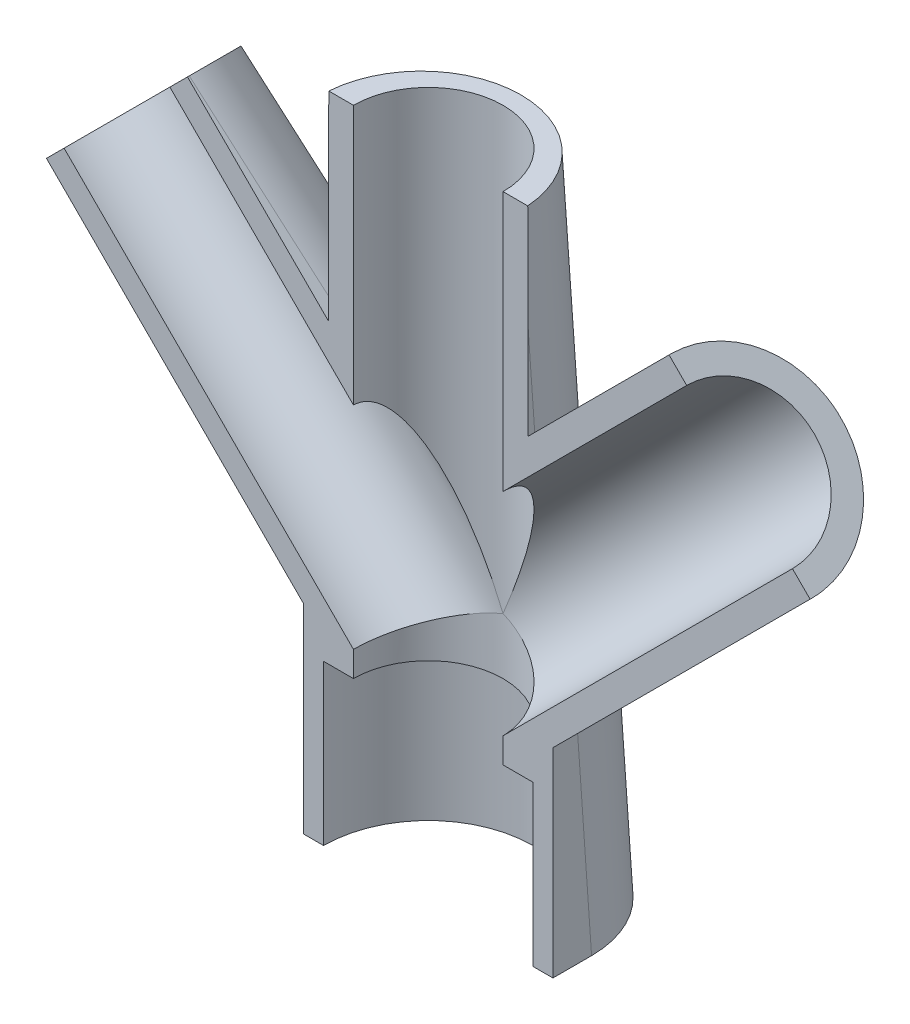
from build123d import *

# Parameters (mm, degrees)
EXTRUDE_634_DEPTH           = 12.5
SKETCH_4_R                  = 3.75
CUT_EXTRUDE_991_DEPTH       = 41.057008652
CUT_EXTRUDE_1141_REACH      = 47.49
CUT_EXTRUDE_1141_END_RADIUS = 3.75
SKETCH_5_R                  = 3.75
SKETCH_9_R                  = 5.25
CUT_EXTRUDE_1315_DEPTH      = 8
DRAFT_2_ANGLE               = 4
FILLET_8_R                  = 5
SKETCH_10_W                 = 49.037593782
SKETCH_10_H                 = 8.594475989
CUT_EXTRUDE_3_DEPTH         = 41.280697872


with BuildPart() as part:
    # Эскиз3 → Extrude 634 (new body)
    with BuildSketch(Plane.XY):
        Polygon((-6.25, 0), (-19.142135624, 12.892135624), (-12.071067812, 19.963203436), (-5, 12.892135624), (-5, 22.892135624), (5, 22.892135624), (5, 12.892135624), (12.071067812, 19.963203436), (19.142135624, 12.892135624), (6.25, 0), (6.25, -10), (-6.25, -10), align=None)
    extrude(amount=EXTRUDE_634_DEPTH)

    # Эскиз4 → Cut-Extrude 991 (cut, through all)
    with BuildSketch(Plane(origin=(0, 22.892135624, 0), x_dir=(-1, 0, 0), z_dir=(0, 1, 0))):
        with Locations(Location((0, 6.25, 0), (0, 0, 90))):
            Circle(SKETCH_4_R)
    extrude(amount=-CUT_EXTRUDE_991_DEPTH, mode=Mode.SUBTRACT)

    # Cut-Extrude 1141: up to this cylinder (the profile starts outside it)
    cut_extrude_1141_end = Plane(origin=(0, 16.42767, 6.25), z_dir=(0, 1, 0)) * Cylinder(CUT_EXTRUDE_1141_END_RADIUS, 103.48, mode=Mode.PRIVATE)
    # Эскиз5 → Cut-Extrude 1141 (cut, up to the surface)
    with BuildSketch(Plane(origin=(-16.017135624, 16.017135624, 0), x_dir=(0, 0, 1), z_dir=(-0.707106781186544, 0.7071067811865511, 0)), mode=Mode.PRIVATE) as cut_extrude_1141_sk1:
        with Locations(Location((6.25, 0.580582618, 0), (0, 0, 270))):
            Circle(SKETCH_5_R)
    cut_extrude_1141_tool1 = extrude(cut_extrude_1141_sk1.sketch, amount=-CUT_EXTRUDE_1141_REACH, mode=Mode.PRIVATE) - cut_extrude_1141_end
    cut_extrude_1141 = cut_extrude_1141_tool1.solids().sort_by_distance((-15.606602, 16.42767, 6.25))[0]
    add(cut_extrude_1141, mode=Mode.SUBTRACT)

    # Зеркальное отражение1: Cut-Extrude 1141 across plane
    add(cut_extrude_1141.mirror(Plane(origin=(0, 0, 0), x_dir=(0, 0, 1), z_dir=(1, 0, 0))), mode=Mode.SUBTRACT)

    # Эскиз9 → Cut-Extrude 1315 (cut)
    with BuildSketch(Plane.XZ.offset(10)):
        with Locations((0, 6.25)):
            Circle(SKETCH_9_R)
    extrude(amount=-CUT_EXTRUDE_1315_DEPTH, mode=Mode.SUBTRACT)

    # Уклон2
    draft_2_faces = [part.faces().sort_by_distance(p)[0] for p in [
        (0, 7.90429112, 0),
        (0, 7.90429112, 12.5),
    ]]
    draft(draft_2_faces, Plane.ZX, DRAFT_2_ANGLE)

    # Скругление8
    # the kernel refuses this fillet: 5 mm, written as the material it takes off along each edge
    with BuildSketch(Plane(origin=(-3.402831812, 4.489303811, 0.313922703), x_dir=(0.707968543318461, -0.7045235927201029, -0.049265088777904954), z_dir=(0.7062439675293066, 0.7062439675293118, 0.04938538910366094))) as fillet_8_piece_1_section:
        with BuildLine():
            CenterArc((FILLET_8_R * 0.951833326591, -FILLET_8_R), FILLET_8_R, 90, 87.17272264)
            Line((-FILLET_8_R * 0.0469494411747, -FILLET_8_R * 0.950674724384), (-FILLET_8_R * 0.06692509653, -FILLET_8_R * 0.949688218872))
            Line((-FILLET_8_R * 0.06692509653, -FILLET_8_R * 0.949688218872), (-FILLET_8_R * 0.0190366665318, FILLET_8_R * 0.02))
            Line((-FILLET_8_R * 0.0190366665318, FILLET_8_R * 0.02), (FILLET_8_R * 0.951833326591, FILLET_8_R * 0.02))
            Line((FILLET_8_R * 0.951833326591, FILLET_8_R * 0.02), (FILLET_8_R * 0.951833326591, 0))
        make_face()
    fillet_8_piece_1 = extrude(amount=33.8080501, mode=Mode.PRIVATE)
    fillet_8_piece_1 = split(fillet_8_piece_1, bisect_by=Plane(origin=(12.895577991, 19.138693257, 2.078418466), z_dir=(-0.7071067811865445, -0.7071067811865507, 0)), keep=Keep.TOP, mode=Mode.PRIVATE)
    fillet_8_piece_1 = split(fillet_8_piece_1, bisect_by=Plane(origin=(5, 15.190904261, 2.078418466), z_dir=(1, 0, 0)), keep=Keep.TOP, mode=Mode.PRIVATE)
    add(fillet_8_piece_1, mode=Mode.SUBTRACT)
    with BuildSketch(Plane(origin=(5, 35.361686252, 2.472729985), x_dir=(-1, 0, 0), z_dir=(0, -0.9975640502598243, -0.06975647374412541))) as fillet_8_piece_2_section:
        with BuildLine():
            CenterArc((FILLET_8_R, -FILLET_8_R), FILLET_8_R, 90, 90)
            Line((0, -FILLET_8_R), (-FILLET_8_R * 0.02, -FILLET_8_R))
            Line((-FILLET_8_R * 0.02, -FILLET_8_R), (-FILLET_8_R * 0.02, FILLET_8_R * 0.02))
            Line((-FILLET_8_R * 0.02, FILLET_8_R * 0.02), (FILLET_8_R, FILLET_8_R * 0.02))
            Line((FILLET_8_R, FILLET_8_R * 0.02), (FILLET_8_R, 0))
        make_face()
    fillet_8_piece_2 = extrude(amount=35.024418981, mode=Mode.PRIVATE)
    fillet_8_piece_2 = split(fillet_8_piece_2, bisect_by=Plane(origin=(3.763647995, 22.892135624, 2.280840285), z_dir=(0, -1, 0)), keep=Keep.TOP, mode=Mode.PRIVATE)
    fillet_8_piece_2 = split(fillet_8_piece_2, bisect_by=Plane(origin=(6.572735996, 14.46487162, 2.280840285), z_dir=(-0.7071067811865501, 0.707106781186545, 0)), keep=Keep.TOP, mode=Mode.PRIVATE)
    add(fillet_8_piece_2, mode=Mode.SUBTRACT)
    with BuildSketch(Plane(origin=(-5, 0.422584995, 0.029550022), x_dir=(1, 0, 0), z_dir=(0, 0.9975640502598243, 0.06975647374412541))) as fillet_8_piece_3_section:
        with BuildLine():
            CenterArc((FILLET_8_R, -FILLET_8_R), FILLET_8_R, 90, 90)
            Line((0, -FILLET_8_R), (-FILLET_8_R * 0.02, -FILLET_8_R))
            Line((-FILLET_8_R * 0.02, -FILLET_8_R), (-FILLET_8_R * 0.02, FILLET_8_R * 0.02))
            Line((-FILLET_8_R * 0.02, FILLET_8_R * 0.02), (FILLET_8_R, FILLET_8_R * 0.02))
            Line((FILLET_8_R, FILLET_8_R * 0.02), (FILLET_8_R, 0))
        make_face()
    fillet_8_piece_3 = extrude(amount=35.024418981, mode=Mode.PRIVATE)
    fillet_8_piece_3 = split(fillet_8_piece_3, bisect_by=Plane(origin=(-3.763647995, 22.892135624, 2.280840285), z_dir=(0, -1, 0)), keep=Keep.TOP, mode=Mode.PRIVATE)
    fillet_8_piece_3 = split(fillet_8_piece_3, bisect_by=Plane(origin=(-6.572735996, 14.46487162, 2.280840285), z_dir=(0.7071067811865512, 0.7071067811865438, 0)), keep=Keep.TOP, mode=Mode.PRIVATE)
    add(fillet_8_piece_3, mode=Mode.SUBTRACT)
    with BuildSketch(Plane(origin=(-20.473899624, 28.366035248, 1.983546412), x_dir=(-0.707968543318462, -0.7045235927201018, -0.04926508877790491), z_dir=(0.7062439675293055, -0.706243967529313, -0.04938538910366102))) as fillet_8_piece_4_section:
        with BuildLine():
            CenterArc((FILLET_8_R * 0.951833326591, -FILLET_8_R), FILLET_8_R, 90, 87.17272264)
            Line((-FILLET_8_R * 0.0469494411747, -FILLET_8_R * 0.950674724384), (-FILLET_8_R * 0.06692509653, -FILLET_8_R * 0.949688218872))
            Line((-FILLET_8_R * 0.06692509653, -FILLET_8_R * 0.949688218872), (-FILLET_8_R * 0.0190366665318, FILLET_8_R * 0.02))
            Line((-FILLET_8_R * 0.0190366665318, FILLET_8_R * 0.02), (FILLET_8_R * 0.951833326591, FILLET_8_R * 0.02))
            Line((FILLET_8_R * 0.951833326591, FILLET_8_R * 0.02), (FILLET_8_R * 0.951833326591, 0))
        make_face()
    fillet_8_piece_4 = extrude(amount=33.8080501, mode=Mode.PRIVATE)
    fillet_8_piece_4 = split(fillet_8_piece_4, bisect_by=Plane(origin=(-12.895577991, 19.138693257, 2.078418466), z_dir=(0.7071067811865444, -0.7071067811865508, 0)), keep=Keep.TOP, mode=Mode.PRIVATE)
    fillet_8_piece_4 = split(fillet_8_piece_4, bisect_by=Plane(origin=(-5, 15.190904261, 2.078418466), z_dir=(-1, 0, 0)), keep=Keep.TOP, mode=Mode.PRIVATE)
    add(fillet_8_piece_4, mode=Mode.SUBTRACT)
    with BuildSketch(Plane(origin=(3.024785141, -9.274785141, -0.648556156), x_dir=(0.034920743526734764, -0.034920743526734764, 0.9987797972241329), z_dir=(-0.7062439675293093, 0.7062439675293093, 0.04938538910366077))) as fillet_8_piece_5_section:
        with BuildLine():
            CenterArc((FILLET_8_R * 1.0506041048, FILLET_8_R), FILLET_8_R, 177.17272264, 92.82727736)
            Line((FILLET_8_R * 0.0518213370326, FILLET_8_R * 1.04932527562), (FILLET_8_R * 0.0318456816773, FILLET_8_R * 1.05031178113))
            Line((FILLET_8_R * 0.0318456816773, FILLET_8_R * 1.05031178113), (-FILLET_8_R * 0.021012082096, -FILLET_8_R * 0.02))
            Line((-FILLET_8_R * 0.021012082096, -FILLET_8_R * 0.02), (FILLET_8_R * 1.0506041048, -FILLET_8_R * 0.02))
            Line((FILLET_8_R * 1.0506041048, -FILLET_8_R * 0.02), (FILLET_8_R * 1.0506041048, 0))
        make_face()
    fillet_8_piece_5 = extrude(amount=44.519609867, mode=Mode.PRIVATE)
    fillet_8_piece_5 = split(fillet_8_piece_5, bisect_by=Plane(origin=(-6.25, 7.634264741, 1.775571736), z_dir=(-1, 0, 0)), keep=Keep.TOP, mode=Mode.PRIVATE)
    fillet_8_piece_5 = split(fillet_8_piece_5, bisect_by=Plane(origin=(-18.350004337, 13.68426691, 1.775571736), z_dir=(0.7071067811865444, -0.7071067811865508, 0)), keep=Keep.TOP, mode=Mode.PRIVATE)
    add(fillet_8_piece_5, mode=Mode.SUBTRACT)
    with BuildSketch(Plane(origin=(-6.25, -22.469550628, -1.571224041), x_dir=(0, -0.06975647374412541, 0.9975640502598242), z_dir=(0, 0.9975640502598243, 0.06975647374412541))) as fillet_8_piece_6_section:
        with BuildLine():
            CenterArc((FILLET_8_R, FILLET_8_R), FILLET_8_R, 180, 90)
            Line((0, FILLET_8_R), (-FILLET_8_R * 0.02, FILLET_8_R))
            Line((-FILLET_8_R * 0.02, FILLET_8_R), (-FILLET_8_R * 0.02, -FILLET_8_R * 0.02))
            Line((-FILLET_8_R * 0.02, -FILLET_8_R * 0.02), (FILLET_8_R, -FILLET_8_R * 0.02))
            Line((FILLET_8_R, -FILLET_8_R * 0.02), (FILLET_8_R, 0))
        make_face()
    fillet_8_piece_6 = extrude(amount=35.024418981, mode=Mode.PRIVATE)
    fillet_8_piece_6 = split(fillet_8_piece_6, bisect_by=Plane(origin=(-2.999285634, -3.250714366, 0.827701668), z_dir=(-0.7071067811865476, -0.7071067811865476, 0)), keep=Keep.TOP, mode=Mode.PRIVATE)
    fillet_8_piece_6 = split(fillet_8_piece_6, bisect_by=Plane(origin=(-5.249047512, -10, 0.827701668), z_dir=(0, 1, 0)), keep=Keep.TOP, mode=Mode.PRIVATE)
    add(fillet_8_piece_6, mode=Mode.SUBTRACT)
    with BuildSketch(Plane(origin=(6.25, 12.469550628, 0.871955922), x_dir=(-1, 0, 0), z_dir=(0, -0.9975640502598243, -0.06975647374412541))) as fillet_8_piece_7_section:
        with BuildLine():
            CenterArc((FILLET_8_R, -FILLET_8_R), FILLET_8_R, 90, 90)
            Line((0, -FILLET_8_R), (-FILLET_8_R * 0.02, -FILLET_8_R))
            Line((-FILLET_8_R * 0.02, -FILLET_8_R), (-FILLET_8_R * 0.02, FILLET_8_R * 0.02))
            Line((-FILLET_8_R * 0.02, FILLET_8_R * 0.02), (FILLET_8_R, FILLET_8_R * 0.02))
            Line((FILLET_8_R, FILLET_8_R * 0.02), (FILLET_8_R, 0))
        make_face()
    fillet_8_piece_7 = extrude(amount=35.024418981, mode=Mode.PRIVATE)
    fillet_8_piece_7 = split(fillet_8_piece_7, bisect_by=Plane(origin=(5.249047512, -10, 0.827701668), z_dir=(0, 1, 0)), keep=Keep.TOP, mode=Mode.PRIVATE)
    fillet_8_piece_7 = split(fillet_8_piece_7, bisect_by=Plane(origin=(2.999285634, -3.250714366, 0.827701668), z_dir=(0.7071067811865476, -0.7071067811865476, 0)), keep=Keep.TOP, mode=Mode.PRIVATE)
    add(fillet_8_piece_7, mode=Mode.SUBTRACT)
    with BuildSketch(Plane(origin=(28.416920765, 22.166920765, 1.5500621), x_dir=(-0.7079685433184584, 0.7045235927201055, 0.04926508877790521), z_dir=(-0.7062439675293093, -0.7062439675293093, -0.04938538910366077))) as fillet_8_piece_8_section:
        with BuildLine():
            CenterArc((FILLET_8_R * 1.0506041048, -FILLET_8_R), FILLET_8_R, 90, 92.82727736)
            Line((FILLET_8_R * 0.0518213370326, -FILLET_8_R * 1.04932527562), (FILLET_8_R * 0.0318456816773, -FILLET_8_R * 1.05031178113))
            Line((FILLET_8_R * 0.0318456816773, -FILLET_8_R * 1.05031178113), (-FILLET_8_R * 0.021012082096, FILLET_8_R * 0.02))
            Line((-FILLET_8_R * 0.021012082096, FILLET_8_R * 0.02), (FILLET_8_R * 1.0506041048, FILLET_8_R * 0.02))
            Line((FILLET_8_R * 1.0506041048, FILLET_8_R * 0.02), (FILLET_8_R * 1.0506041048, 0))
        make_face()
    fillet_8_piece_8 = extrude(amount=44.519609867, mode=Mode.PRIVATE)
    fillet_8_piece_8 = split(fillet_8_piece_8, bisect_by=Plane(origin=(18.350004337, 13.68426691, 1.775571736), z_dir=(-0.7071067811865445, -0.7071067811865507, 0)), keep=Keep.TOP, mode=Mode.PRIVATE)
    fillet_8_piece_8 = split(fillet_8_piece_8, bisect_by=Plane(origin=(6.25, 7.634264741, 1.775571736), z_dir=(1, 0, 0)), keep=Keep.TOP, mode=Mode.PRIVATE)
    add(fillet_8_piece_8, mode=Mode.SUBTRACT)
    with BuildSketch(Plane(origin=(-6.25, -22.469550628, 14.071224041), x_dir=(0, -0.06975647374412541, -0.9975640502598242), z_dir=(0, 0.9975640502598243, -0.06975647374412541))) as fillet_8_piece_9_section:
        with BuildLine():
            CenterArc((FILLET_8_R, -FILLET_8_R), FILLET_8_R, 90, 90)
            Line((0, -FILLET_8_R), (-FILLET_8_R * 0.02, -FILLET_8_R))
            Line((-FILLET_8_R * 0.02, -FILLET_8_R), (-FILLET_8_R * 0.02, FILLET_8_R * 0.02))
            Line((-FILLET_8_R * 0.02, FILLET_8_R * 0.02), (FILLET_8_R, FILLET_8_R * 0.02))
            Line((FILLET_8_R, FILLET_8_R * 0.02), (FILLET_8_R, 0))
        make_face()
    fillet_8_piece_9 = extrude(amount=35.024418981, mode=Mode.PRIVATE)
    fillet_8_piece_9 = split(fillet_8_piece_9, bisect_by=Plane(origin=(-2.999285634, -3.250714366, 11.672298332), z_dir=(-0.7071067811865476, -0.7071067811865476, 0)), keep=Keep.TOP, mode=Mode.PRIVATE)
    fillet_8_piece_9 = split(fillet_8_piece_9, bisect_by=Plane(origin=(-5.249047512, -10, 11.672298332), z_dir=(0, 1, 0)), keep=Keep.TOP, mode=Mode.PRIVATE)
    add(fillet_8_piece_9, mode=Mode.SUBTRACT)
    with BuildSketch(Plane(origin=(6.25, 12.469550628, 11.628044078), x_dir=(-1, 0, 0), z_dir=(0, -0.9975640502598243, 0.06975647374412541))) as fillet_8_piece_10_section:
        with BuildLine():
            CenterArc((FILLET_8_R, FILLET_8_R), FILLET_8_R, 180, 90)
            Line((0, FILLET_8_R), (-FILLET_8_R * 0.02, FILLET_8_R))
            Line((-FILLET_8_R * 0.02, FILLET_8_R), (-FILLET_8_R * 0.02, -FILLET_8_R * 0.02))
            Line((-FILLET_8_R * 0.02, -FILLET_8_R * 0.02), (FILLET_8_R, -FILLET_8_R * 0.02))
            Line((FILLET_8_R, -FILLET_8_R * 0.02), (FILLET_8_R, 0))
        make_face()
    fillet_8_piece_10 = extrude(amount=35.024418981, mode=Mode.PRIVATE)
    fillet_8_piece_10 = split(fillet_8_piece_10, bisect_by=Plane(origin=(5.249047512, -10, 11.672298332), z_dir=(0, 1, 0)), keep=Keep.TOP, mode=Mode.PRIVATE)
    fillet_8_piece_10 = split(fillet_8_piece_10, bisect_by=Plane(origin=(2.999285634, -3.250714366, 11.672298332), z_dir=(0.7071067811865476, -0.7071067811865476, 0)), keep=Keep.TOP, mode=Mode.PRIVATE)
    add(fillet_8_piece_10, mode=Mode.SUBTRACT)
    with BuildSketch(Plane(origin=(28.416920765, 22.166920765, 10.9499379), x_dir=(-0.7079685433184584, 0.7045235927201055, -0.049265088777905426), z_dir=(-0.7062439675293093, -0.7062439675293093, 0.04938538910366077))) as fillet_8_piece_11_section:
        with BuildLine():
            CenterArc((FILLET_8_R * 1.0506041048, FILLET_8_R), FILLET_8_R, 177.17272264, 92.82727736)
            Line((FILLET_8_R * 0.0518213370326, FILLET_8_R * 1.04932527562), (FILLET_8_R * 0.0318456816773, FILLET_8_R * 1.05031178113))
            Line((FILLET_8_R * 0.0318456816773, FILLET_8_R * 1.05031178113), (-FILLET_8_R * 0.021012082096, -FILLET_8_R * 0.02))
            Line((-FILLET_8_R * 0.021012082096, -FILLET_8_R * 0.02), (FILLET_8_R * 1.0506041048, -FILLET_8_R * 0.02))
            Line((FILLET_8_R * 1.0506041048, -FILLET_8_R * 0.02), (FILLET_8_R * 1.0506041048, 0))
        make_face()
    fillet_8_piece_11 = extrude(amount=44.519609867, mode=Mode.PRIVATE)
    fillet_8_piece_11 = split(fillet_8_piece_11, bisect_by=Plane(origin=(18.350004337, 13.68426691, 10.724428264), z_dir=(-0.7071067811865445, -0.7071067811865507, 0)), keep=Keep.TOP, mode=Mode.PRIVATE)
    fillet_8_piece_11 = split(fillet_8_piece_11, bisect_by=Plane(origin=(6.25, 7.634264741, 10.724428264), z_dir=(1, 0, 0)), keep=Keep.TOP, mode=Mode.PRIVATE)
    add(fillet_8_piece_11, mode=Mode.SUBTRACT)
    with BuildSketch(Plane(origin=(-3.402831812, 4.489303811, 12.186077297), x_dir=(0.707968543318461, -0.7045235927201029, 0.04926508877790491), z_dir=(0.7062439675293066, 0.7062439675293118, -0.04938538910366094))) as fillet_8_piece_12_section:
        with BuildLine():
            CenterArc((FILLET_8_R * 0.951833326591, FILLET_8_R), FILLET_8_R, 182.82727736, 87.17272264)
            Line((-FILLET_8_R * 0.0469494411747, FILLET_8_R * 0.950674724384), (-FILLET_8_R * 0.06692509653, FILLET_8_R * 0.949688218872))
            Line((-FILLET_8_R * 0.06692509653, FILLET_8_R * 0.949688218872), (-FILLET_8_R * 0.0190366665318, -FILLET_8_R * 0.02))
            Line((-FILLET_8_R * 0.0190366665318, -FILLET_8_R * 0.02), (FILLET_8_R * 0.951833326591, -FILLET_8_R * 0.02))
            Line((FILLET_8_R * 0.951833326591, -FILLET_8_R * 0.02), (FILLET_8_R * 0.951833326591, 0))
        make_face()
    fillet_8_piece_12 = extrude(amount=33.8080501, mode=Mode.PRIVATE)
    fillet_8_piece_12 = split(fillet_8_piece_12, bisect_by=Plane(origin=(12.895577991, 19.138693257, 10.421581534), z_dir=(-0.7071067811865445, -0.7071067811865507, 0)), keep=Keep.TOP, mode=Mode.PRIVATE)
    fillet_8_piece_12 = split(fillet_8_piece_12, bisect_by=Plane(origin=(5, 15.190904261, 10.421581534), z_dir=(1, 0, 0)), keep=Keep.TOP, mode=Mode.PRIVATE)
    add(fillet_8_piece_12, mode=Mode.SUBTRACT)
    with BuildSketch(Plane(origin=(5, 35.361686252, 10.027270015), x_dir=(-1, 0, 0), z_dir=(0, -0.9975640502598243, 0.06975647374412541))) as fillet_8_piece_13_section:
        with BuildLine():
            CenterArc((FILLET_8_R, FILLET_8_R), FILLET_8_R, 180, 90)
            Line((0, FILLET_8_R), (-FILLET_8_R * 0.02, FILLET_8_R))
            Line((-FILLET_8_R * 0.02, FILLET_8_R), (-FILLET_8_R * 0.02, -FILLET_8_R * 0.02))
            Line((-FILLET_8_R * 0.02, -FILLET_8_R * 0.02), (FILLET_8_R, -FILLET_8_R * 0.02))
            Line((FILLET_8_R, -FILLET_8_R * 0.02), (FILLET_8_R, 0))
        make_face()
    fillet_8_piece_13 = extrude(amount=35.024418981, mode=Mode.PRIVATE)
    fillet_8_piece_13 = split(fillet_8_piece_13, bisect_by=Plane(origin=(3.763647995, 22.892135624, 10.219159715), z_dir=(0, -1, 0)), keep=Keep.TOP, mode=Mode.PRIVATE)
    fillet_8_piece_13 = split(fillet_8_piece_13, bisect_by=Plane(origin=(6.572735996, 14.46487162, 10.219159715), z_dir=(-0.7071067811865501, 0.707106781186545, 0)), keep=Keep.TOP, mode=Mode.PRIVATE)
    add(fillet_8_piece_13, mode=Mode.SUBTRACT)
    with BuildSketch(Plane(origin=(-5, 0.422584995, 12.470449978), x_dir=(1, 0, 0), z_dir=(0, 0.9975640502598243, -0.06975647374412541))) as fillet_8_piece_14_section:
        with BuildLine():
            CenterArc((FILLET_8_R, FILLET_8_R), FILLET_8_R, 180, 90)
            Line((0, FILLET_8_R), (-FILLET_8_R * 0.02, FILLET_8_R))
            Line((-FILLET_8_R * 0.02, FILLET_8_R), (-FILLET_8_R * 0.02, -FILLET_8_R * 0.02))
            Line((-FILLET_8_R * 0.02, -FILLET_8_R * 0.02), (FILLET_8_R, -FILLET_8_R * 0.02))
            Line((FILLET_8_R, -FILLET_8_R * 0.02), (FILLET_8_R, 0))
        make_face()
    fillet_8_piece_14 = extrude(amount=35.024418981, mode=Mode.PRIVATE)
    fillet_8_piece_14 = split(fillet_8_piece_14, bisect_by=Plane(origin=(-3.763647995, 22.892135624, 10.219159715), z_dir=(0, -1, 0)), keep=Keep.TOP, mode=Mode.PRIVATE)
    fillet_8_piece_14 = split(fillet_8_piece_14, bisect_by=Plane(origin=(-6.572735996, 14.46487162, 10.219159715), z_dir=(0.7071067811865512, 0.7071067811865438, 0)), keep=Keep.TOP, mode=Mode.PRIVATE)
    add(fillet_8_piece_14, mode=Mode.SUBTRACT)
    with BuildSketch(Plane(origin=(-20.473899624, 28.366035248, 10.516453588), x_dir=(-0.7079685433184622, -0.7045235927201017, 0.04926508877790538), z_dir=(0.7062439675293055, -0.706243967529313, 0.04938538910366102))) as fillet_8_piece_15_section:
        with BuildLine():
            CenterArc((FILLET_8_R * 0.951833326591, FILLET_8_R), FILLET_8_R, 182.82727736, 87.17272264)
            Line((-FILLET_8_R * 0.0469494411747, FILLET_8_R * 0.950674724384), (-FILLET_8_R * 0.06692509653, FILLET_8_R * 0.949688218872))
            Line((-FILLET_8_R * 0.06692509653, FILLET_8_R * 0.949688218872), (-FILLET_8_R * 0.0190366665318, -FILLET_8_R * 0.02))
            Line((-FILLET_8_R * 0.0190366665318, -FILLET_8_R * 0.02), (FILLET_8_R * 0.951833326591, -FILLET_8_R * 0.02))
            Line((FILLET_8_R * 0.951833326591, -FILLET_8_R * 0.02), (FILLET_8_R * 0.951833326591, 0))
        make_face()
    fillet_8_piece_15 = extrude(amount=33.8080501, mode=Mode.PRIVATE)
    fillet_8_piece_15 = split(fillet_8_piece_15, bisect_by=Plane(origin=(-12.895577991, 19.138693257, 10.421581534), z_dir=(0.7071067811865444, -0.7071067811865508, 0)), keep=Keep.TOP, mode=Mode.PRIVATE)
    fillet_8_piece_15 = split(fillet_8_piece_15, bisect_by=Plane(origin=(-5, 15.190904261, 10.421581534), z_dir=(-1, 0, 0)), keep=Keep.TOP, mode=Mode.PRIVATE)
    add(fillet_8_piece_15, mode=Mode.SUBTRACT)
    with BuildSketch(Plane(origin=(3.024785141, -9.274785141, 13.148556156), x_dir=(0.034920743526734764, -0.034920743526734764, -0.9987797972241329), z_dir=(-0.7062439675293093, 0.7062439675293093, -0.04938538910366077))) as fillet_8_piece_16_section:
        with BuildLine():
            CenterArc((FILLET_8_R * 1.0506041048, -FILLET_8_R), FILLET_8_R, 90, 92.82727736)
            Line((FILLET_8_R * 0.0518213370326, -FILLET_8_R * 1.04932527562), (FILLET_8_R * 0.0318456816773, -FILLET_8_R * 1.05031178113))
            Line((FILLET_8_R * 0.0318456816773, -FILLET_8_R * 1.05031178113), (-FILLET_8_R * 0.021012082096, FILLET_8_R * 0.02))
            Line((-FILLET_8_R * 0.021012082096, FILLET_8_R * 0.02), (FILLET_8_R * 1.0506041048, FILLET_8_R * 0.02))
            Line((FILLET_8_R * 1.0506041048, FILLET_8_R * 0.02), (FILLET_8_R * 1.0506041048, 0))
        make_face()
    fillet_8_piece_16 = extrude(amount=44.519609867, mode=Mode.PRIVATE)
    fillet_8_piece_16 = split(fillet_8_piece_16, bisect_by=Plane(origin=(-6.25, 7.634264741, 10.724428264), z_dir=(-1, 0, 0)), keep=Keep.TOP, mode=Mode.PRIVATE)
    fillet_8_piece_16 = split(fillet_8_piece_16, bisect_by=Plane(origin=(-18.350004337, 13.68426691, 10.724428264), z_dir=(0.7071067811865444, -0.7071067811865508, 0)), keep=Keep.TOP, mode=Mode.PRIVATE)
    add(fillet_8_piece_16, mode=Mode.SUBTRACT)
    with BuildSketch(Plane(origin=(5, 35.361686252, 2.472729985), x_dir=(-1, 0, 0), z_dir=(0, -0.9975640502598243, -0.06975647374412541))) as fillet_8_piece_17a_section:
        with BuildLine():
            CenterArc((FILLET_8_R, -FILLET_8_R), FILLET_8_R, 90, 90)
            Line((0, -FILLET_8_R), (-FILLET_8_R * 0.02, -FILLET_8_R))
            Line((-FILLET_8_R * 0.02, -FILLET_8_R), (-FILLET_8_R * 0.02, FILLET_8_R * 0.02))
            Line((-FILLET_8_R * 0.02, FILLET_8_R * 0.02), (FILLET_8_R, FILLET_8_R * 0.02))
            Line((FILLET_8_R, FILLET_8_R * 0.02), (FILLET_8_R, 0))
        make_face()
    fillet_8_piece_17a = extrude(amount=35.024418981, mode=Mode.PRIVATE)
    fillet_8_piece_17a = split(fillet_8_piece_17a, bisect_by=Plane(origin=(1.092194354, 8.984329978, 1.628858747), z_dir=(0.7071067811865501, -0.707106781186545, 0)), keep=Keep.TOP, mode=Mode.PRIVATE)
    with BuildSketch(Plane(origin=(-3.402831812, 4.489303811, 0.313922703), x_dir=(0.707968543318461, -0.7045235927201029, -0.049265088777904954), z_dir=(0.7062439675293066, 0.7062439675293118, 0.04938538910366094))) as fillet_8_piece_17b_section:
        with BuildLine():
            CenterArc((FILLET_8_R * 0.951833326591, -FILLET_8_R), FILLET_8_R, 90, 87.17272264)
            Line((-FILLET_8_R * 0.0469494411747, -FILLET_8_R * 0.950674724384), (-FILLET_8_R * 0.06692509653, -FILLET_8_R * 0.949688218872))
            Line((-FILLET_8_R * 0.06692509653, -FILLET_8_R * 0.949688218872), (-FILLET_8_R * 0.0190366665318, FILLET_8_R * 0.02))
            Line((-FILLET_8_R * 0.0190366665318, FILLET_8_R * 0.02), (FILLET_8_R * 0.951833326591, FILLET_8_R * 0.02))
            Line((FILLET_8_R * 0.951833326591, FILLET_8_R * 0.02), (FILLET_8_R * 0.951833326591, 0))
        make_face()
    fillet_8_piece_17b = extrude(amount=33.8080501, mode=Mode.PRIVATE)
    fillet_8_piece_17b = split(fillet_8_piece_17b, bisect_by=Plane(origin=(5, 7.643322174, 1.670148542), z_dir=(-1, 0, 0)), keep=Keep.TOP, mode=Mode.PRIVATE)
    fillet_8_piece_17 = fillet_8_piece_17a & fillet_8_piece_17b
    add(fillet_8_piece_17, mode=Mode.SUBTRACT)
    with BuildSketch(Plane(origin=(-20.473899624, 28.366035248, 1.983546412), x_dir=(-0.707968543318462, -0.7045235927201018, -0.04926508877790491), z_dir=(0.7062439675293055, -0.706243967529313, -0.04938538910366102))) as fillet_8_piece_18a_section:
        with BuildLine():
            CenterArc((FILLET_8_R * 0.951833326591, -FILLET_8_R), FILLET_8_R, 90, 87.17272264)
            Line((-FILLET_8_R * 0.0469494411747, -FILLET_8_R * 0.950674724384), (-FILLET_8_R * 0.06692509653, -FILLET_8_R * 0.949688218872))
            Line((-FILLET_8_R * 0.06692509653, -FILLET_8_R * 0.949688218872), (-FILLET_8_R * 0.0190366665318, FILLET_8_R * 0.02))
            Line((-FILLET_8_R * 0.0190366665318, FILLET_8_R * 0.02), (FILLET_8_R * 0.951833326591, FILLET_8_R * 0.02))
            Line((FILLET_8_R * 0.951833326591, FILLET_8_R * 0.02), (FILLET_8_R * 0.951833326591, 0))
        make_face()
    fillet_8_piece_18a = extrude(amount=33.8080501, mode=Mode.PRIVATE)
    fillet_8_piece_18a = split(fillet_8_piece_18a, bisect_by=Plane(origin=(-5, 7.643322174, 1.670148542), z_dir=(1, 0, 0)), keep=Keep.TOP, mode=Mode.PRIVATE)
    with BuildSketch(Plane(origin=(-5, 0.422584995, 0.029550022), x_dir=(1, 0, 0), z_dir=(0, 0.9975640502598243, 0.06975647374412541))) as fillet_8_piece_18b_section:
        with BuildLine():
            CenterArc((FILLET_8_R, -FILLET_8_R), FILLET_8_R, 90, 90)
            Line((0, -FILLET_8_R), (-FILLET_8_R * 0.02, -FILLET_8_R))
            Line((-FILLET_8_R * 0.02, -FILLET_8_R), (-FILLET_8_R * 0.02, FILLET_8_R * 0.02))
            Line((-FILLET_8_R * 0.02, FILLET_8_R * 0.02), (FILLET_8_R, FILLET_8_R * 0.02))
            Line((FILLET_8_R, FILLET_8_R * 0.02), (FILLET_8_R, 0))
        make_face()
    fillet_8_piece_18b = extrude(amount=35.024418981, mode=Mode.PRIVATE)
    fillet_8_piece_18b = split(fillet_8_piece_18b, bisect_by=Plane(origin=(-1.092194354, 8.984329978, 1.628858747), z_dir=(-0.7071067811865512, -0.7071067811865438, 0)), keep=Keep.TOP, mode=Mode.PRIVATE)
    fillet_8_piece_18 = fillet_8_piece_18a & fillet_8_piece_18b
    add(fillet_8_piece_18, mode=Mode.SUBTRACT)
    with BuildSketch(Plane(origin=(3.024785141, -9.274785141, -0.648556156), x_dir=(0.034920743526734764, -0.034920743526734764, 0.9987797972241329), z_dir=(-0.7062439675293093, 0.7062439675293093, 0.04938538910366077))) as fillet_8_piece_19a_section:
        with BuildLine():
            CenterArc((FILLET_8_R * 1.0506041048, FILLET_8_R), FILLET_8_R, 177.17272264, 92.82727736)
            Line((FILLET_8_R * 0.0518213370326, FILLET_8_R * 1.04932527562), (FILLET_8_R * 0.0318456816773, FILLET_8_R * 1.05031178113))
            Line((FILLET_8_R * 0.0318456816773, FILLET_8_R * 1.05031178113), (-FILLET_8_R * 0.021012082096, -FILLET_8_R * 0.02))
            Line((-FILLET_8_R * 0.021012082096, -FILLET_8_R * 0.02), (FILLET_8_R * 1.0506041048, -FILLET_8_R * 0.02))
            Line((FILLET_8_R * 1.0506041048, -FILLET_8_R * 0.02), (FILLET_8_R * 1.0506041048, 0))
        make_face()
    fillet_8_piece_19a = extrude(amount=44.519609867, mode=Mode.PRIVATE)
    fillet_8_piece_19a = split(fillet_8_piece_19a, bisect_by=Plane(origin=(-6.25, -3.300210826, 0.918854804), z_dir=(1, 0, 0)), keep=Keep.TOP, mode=Mode.PRIVATE)
    with BuildSketch(Plane(origin=(-6.25, -22.469550628, -1.571224041), x_dir=(0, -0.06975647374412541, 0.9975640502598242), z_dir=(0, 0.9975640502598243, 0.06975647374412541))) as fillet_8_piece_19b_section:
        with BuildLine():
            CenterArc((FILLET_8_R, FILLET_8_R), FILLET_8_R, 180, 90)
            Line((0, FILLET_8_R), (-FILLET_8_R * 0.02, FILLET_8_R))
            Line((-FILLET_8_R * 0.02, FILLET_8_R), (-FILLET_8_R * 0.02, -FILLET_8_R * 0.02))
            Line((-FILLET_8_R * 0.02, -FILLET_8_R * 0.02), (FILLET_8_R, -FILLET_8_R * 0.02))
            Line((FILLET_8_R, -FILLET_8_R * 0.02), (FILLET_8_R, 0))
        make_face()
    fillet_8_piece_19b = extrude(amount=35.024418981, mode=Mode.PRIVATE)
    fillet_8_piece_19b = split(fillet_8_piece_19b, bisect_by=Plane(origin=(-8.432556222, 2.182556222, 1.468496312), z_dir=(0.7071067811865476, 0.7071067811865476, 0)), keep=Keep.TOP, mode=Mode.PRIVATE)
    fillet_8_piece_19 = fillet_8_piece_19a & fillet_8_piece_19b
    add(fillet_8_piece_19, mode=Mode.SUBTRACT)
    with BuildSketch(Plane(origin=(28.416920765, 22.166920765, 1.5500621), x_dir=(-0.7079685433184584, 0.7045235927201055, 0.04926508877790521), z_dir=(-0.7062439675293093, -0.7062439675293093, -0.04938538910366077))) as fillet_8_piece_20a_section:
        with BuildLine():
            CenterArc((FILLET_8_R * 1.0506041048, -FILLET_8_R), FILLET_8_R, 90, 92.82727736)
            Line((FILLET_8_R * 0.0518213370326, -FILLET_8_R * 1.04932527562), (FILLET_8_R * 0.0318456816773, -FILLET_8_R * 1.05031178113))
            Line((FILLET_8_R * 0.0318456816773, -FILLET_8_R * 1.05031178113), (-FILLET_8_R * 0.021012082096, FILLET_8_R * 0.02))
            Line((-FILLET_8_R * 0.021012082096, FILLET_8_R * 0.02), (FILLET_8_R * 1.0506041048, FILLET_8_R * 0.02))
            Line((FILLET_8_R * 1.0506041048, FILLET_8_R * 0.02), (FILLET_8_R * 1.0506041048, 0))
        make_face()
    fillet_8_piece_20a = extrude(amount=44.519609867, mode=Mode.PRIVATE)
    fillet_8_piece_20a = split(fillet_8_piece_20a, bisect_by=Plane(origin=(6.25, -3.300210826, 0.918854804), z_dir=(-1, 0, 0)), keep=Keep.TOP, mode=Mode.PRIVATE)
    with BuildSketch(Plane(origin=(6.25, 12.469550628, 0.871955922), x_dir=(-1, 0, 0), z_dir=(0, -0.9975640502598243, -0.06975647374412541))) as fillet_8_piece_20b_section:
        with BuildLine():
            CenterArc((FILLET_8_R, -FILLET_8_R), FILLET_8_R, 90, 90)
            Line((0, -FILLET_8_R), (-FILLET_8_R * 0.02, -FILLET_8_R))
            Line((-FILLET_8_R * 0.02, -FILLET_8_R), (-FILLET_8_R * 0.02, FILLET_8_R * 0.02))
            Line((-FILLET_8_R * 0.02, FILLET_8_R * 0.02), (FILLET_8_R, FILLET_8_R * 0.02))
            Line((FILLET_8_R, FILLET_8_R * 0.02), (FILLET_8_R, 0))
        make_face()
    fillet_8_piece_20b = extrude(amount=35.024418981, mode=Mode.PRIVATE)
    fillet_8_piece_20b = split(fillet_8_piece_20b, bisect_by=Plane(origin=(8.432556222, 2.182556222, 1.468496312), z_dir=(-0.7071067811865476, 0.7071067811865476, 0)), keep=Keep.TOP, mode=Mode.PRIVATE)
    fillet_8_piece_20 = fillet_8_piece_20a & fillet_8_piece_20b
    add(fillet_8_piece_20, mode=Mode.SUBTRACT)
    with BuildSketch(Plane(origin=(3.024785141, -9.274785141, 13.148556156), x_dir=(0.034920743526734764, -0.034920743526734764, -0.9987797972241329), z_dir=(-0.7062439675293093, 0.7062439675293093, -0.04938538910366077))) as fillet_8_piece_21a_section:
        with BuildLine():
            CenterArc((FILLET_8_R * 1.0506041048, -FILLET_8_R), FILLET_8_R, 90, 92.82727736)
            Line((FILLET_8_R * 0.0518213370326, -FILLET_8_R * 1.04932527562), (FILLET_8_R * 0.0318456816773, -FILLET_8_R * 1.05031178113))
            Line((FILLET_8_R * 0.0318456816773, -FILLET_8_R * 1.05031178113), (-FILLET_8_R * 0.021012082096, FILLET_8_R * 0.02))
            Line((-FILLET_8_R * 0.021012082096, FILLET_8_R * 0.02), (FILLET_8_R * 1.0506041048, FILLET_8_R * 0.02))
            Line((FILLET_8_R * 1.0506041048, FILLET_8_R * 0.02), (FILLET_8_R * 1.0506041048, 0))
        make_face()
    fillet_8_piece_21a = extrude(amount=44.519609867, mode=Mode.PRIVATE)
    fillet_8_piece_21a = split(fillet_8_piece_21a, bisect_by=Plane(origin=(-6.25, -3.300210826, 11.581145196), z_dir=(1, 0, 0)), keep=Keep.TOP, mode=Mode.PRIVATE)
    with BuildSketch(Plane(origin=(-6.25, -22.469550628, 14.071224041), x_dir=(0, -0.06975647374412541, -0.9975640502598242), z_dir=(0, 0.9975640502598243, -0.06975647374412541))) as fillet_8_piece_21b_section:
        with BuildLine():
            CenterArc((FILLET_8_R, -FILLET_8_R), FILLET_8_R, 90, 90)
            Line((0, -FILLET_8_R), (-FILLET_8_R * 0.02, -FILLET_8_R))
            Line((-FILLET_8_R * 0.02, -FILLET_8_R), (-FILLET_8_R * 0.02, FILLET_8_R * 0.02))
            Line((-FILLET_8_R * 0.02, FILLET_8_R * 0.02), (FILLET_8_R, FILLET_8_R * 0.02))
            Line((FILLET_8_R, FILLET_8_R * 0.02), (FILLET_8_R, 0))
        make_face()
    fillet_8_piece_21b = extrude(amount=35.024418981, mode=Mode.PRIVATE)
    fillet_8_piece_21b = split(fillet_8_piece_21b, bisect_by=Plane(origin=(-8.432556222, 2.182556222, 11.031503688), z_dir=(0.7071067811865476, 0.7071067811865476, 0)), keep=Keep.TOP, mode=Mode.PRIVATE)
    fillet_8_piece_21 = fillet_8_piece_21a & fillet_8_piece_21b
    add(fillet_8_piece_21, mode=Mode.SUBTRACT)
    with BuildSketch(Plane(origin=(28.416920765, 22.166920765, 10.9499379), x_dir=(-0.7079685433184584, 0.7045235927201055, -0.049265088777905426), z_dir=(-0.7062439675293093, -0.7062439675293093, 0.04938538910366077))) as fillet_8_piece_22a_section:
        with BuildLine():
            CenterArc((FILLET_8_R * 1.0506041048, FILLET_8_R), FILLET_8_R, 177.17272264, 92.82727736)
            Line((FILLET_8_R * 0.0518213370326, FILLET_8_R * 1.04932527562), (FILLET_8_R * 0.0318456816773, FILLET_8_R * 1.05031178113))
            Line((FILLET_8_R * 0.0318456816773, FILLET_8_R * 1.05031178113), (-FILLET_8_R * 0.021012082096, -FILLET_8_R * 0.02))
            Line((-FILLET_8_R * 0.021012082096, -FILLET_8_R * 0.02), (FILLET_8_R * 1.0506041048, -FILLET_8_R * 0.02))
            Line((FILLET_8_R * 1.0506041048, -FILLET_8_R * 0.02), (FILLET_8_R * 1.0506041048, 0))
        make_face()
    fillet_8_piece_22a = extrude(amount=44.519609867, mode=Mode.PRIVATE)
    fillet_8_piece_22a = split(fillet_8_piece_22a, bisect_by=Plane(origin=(6.25, -3.300210826, 11.581145196), z_dir=(-1, 0, 0)), keep=Keep.TOP, mode=Mode.PRIVATE)
    with BuildSketch(Plane(origin=(6.25, 12.469550628, 11.628044078), x_dir=(-1, 0, 0), z_dir=(0, -0.9975640502598243, 0.06975647374412541))) as fillet_8_piece_22b_section:
        with BuildLine():
            CenterArc((FILLET_8_R, FILLET_8_R), FILLET_8_R, 180, 90)
            Line((0, FILLET_8_R), (-FILLET_8_R * 0.02, FILLET_8_R))
            Line((-FILLET_8_R * 0.02, FILLET_8_R), (-FILLET_8_R * 0.02, -FILLET_8_R * 0.02))
            Line((-FILLET_8_R * 0.02, -FILLET_8_R * 0.02), (FILLET_8_R, -FILLET_8_R * 0.02))
            Line((FILLET_8_R, -FILLET_8_R * 0.02), (FILLET_8_R, 0))
        make_face()
    fillet_8_piece_22b = extrude(amount=35.024418981, mode=Mode.PRIVATE)
    fillet_8_piece_22b = split(fillet_8_piece_22b, bisect_by=Plane(origin=(8.432556222, 2.182556222, 11.031503688), z_dir=(-0.7071067811865476, 0.7071067811865476, 0)), keep=Keep.TOP, mode=Mode.PRIVATE)
    fillet_8_piece_22 = fillet_8_piece_22a & fillet_8_piece_22b
    add(fillet_8_piece_22, mode=Mode.SUBTRACT)
    with BuildSketch(Plane(origin=(5, 35.361686252, 10.027270015), x_dir=(-1, 0, 0), z_dir=(0, -0.9975640502598243, 0.06975647374412541))) as fillet_8_piece_23a_section:
        with BuildLine():
            CenterArc((FILLET_8_R, FILLET_8_R), FILLET_8_R, 180, 90)
            Line((0, FILLET_8_R), (-FILLET_8_R * 0.02, FILLET_8_R))
            Line((-FILLET_8_R * 0.02, FILLET_8_R), (-FILLET_8_R * 0.02, -FILLET_8_R * 0.02))
            Line((-FILLET_8_R * 0.02, -FILLET_8_R * 0.02), (FILLET_8_R, -FILLET_8_R * 0.02))
            Line((FILLET_8_R, -FILLET_8_R * 0.02), (FILLET_8_R, 0))
        make_face()
    fillet_8_piece_23a = extrude(amount=35.024418981, mode=Mode.PRIVATE)
    fillet_8_piece_23a = split(fillet_8_piece_23a, bisect_by=Plane(origin=(1.092194354, 8.984329978, 10.871141253), z_dir=(0.7071067811865501, -0.707106781186545, 0)), keep=Keep.TOP, mode=Mode.PRIVATE)
    with BuildSketch(Plane(origin=(-3.402831812, 4.489303811, 12.186077297), x_dir=(0.707968543318461, -0.7045235927201029, 0.04926508877790491), z_dir=(0.7062439675293066, 0.7062439675293118, -0.04938538910366094))) as fillet_8_piece_23b_section:
        with BuildLine():
            CenterArc((FILLET_8_R * 0.951833326591, FILLET_8_R), FILLET_8_R, 182.82727736, 87.17272264)
            Line((-FILLET_8_R * 0.0469494411747, FILLET_8_R * 0.950674724384), (-FILLET_8_R * 0.06692509653, FILLET_8_R * 0.949688218872))
            Line((-FILLET_8_R * 0.06692509653, FILLET_8_R * 0.949688218872), (-FILLET_8_R * 0.0190366665318, -FILLET_8_R * 0.02))
            Line((-FILLET_8_R * 0.0190366665318, -FILLET_8_R * 0.02), (FILLET_8_R * 0.951833326591, -FILLET_8_R * 0.02))
            Line((FILLET_8_R * 0.951833326591, -FILLET_8_R * 0.02), (FILLET_8_R * 0.951833326591, 0))
        make_face()
    fillet_8_piece_23b = extrude(amount=33.8080501, mode=Mode.PRIVATE)
    fillet_8_piece_23b = split(fillet_8_piece_23b, bisect_by=Plane(origin=(5, 7.643322174, 10.829851458), z_dir=(-1, 0, 0)), keep=Keep.TOP, mode=Mode.PRIVATE)
    fillet_8_piece_23 = fillet_8_piece_23a & fillet_8_piece_23b
    add(fillet_8_piece_23, mode=Mode.SUBTRACT)
    with BuildSketch(Plane(origin=(-20.473899624, 28.366035248, 10.516453588), x_dir=(-0.7079685433184622, -0.7045235927201017, 0.04926508877790538), z_dir=(0.7062439675293055, -0.706243967529313, 0.04938538910366102))) as fillet_8_piece_24a_section:
        with BuildLine():
            CenterArc((FILLET_8_R * 0.951833326591, FILLET_8_R), FILLET_8_R, 182.82727736, 87.17272264)
            Line((-FILLET_8_R * 0.0469494411747, FILLET_8_R * 0.950674724384), (-FILLET_8_R * 0.06692509653, FILLET_8_R * 0.949688218872))
            Line((-FILLET_8_R * 0.06692509653, FILLET_8_R * 0.949688218872), (-FILLET_8_R * 0.0190366665318, -FILLET_8_R * 0.02))
            Line((-FILLET_8_R * 0.0190366665318, -FILLET_8_R * 0.02), (FILLET_8_R * 0.951833326591, -FILLET_8_R * 0.02))
            Line((FILLET_8_R * 0.951833326591, -FILLET_8_R * 0.02), (FILLET_8_R * 0.951833326591, 0))
        make_face()
    fillet_8_piece_24a = extrude(amount=33.8080501, mode=Mode.PRIVATE)
    fillet_8_piece_24a = split(fillet_8_piece_24a, bisect_by=Plane(origin=(-5, 7.643322174, 10.829851458), z_dir=(1, 0, 0)), keep=Keep.TOP, mode=Mode.PRIVATE)
    with BuildSketch(Plane(origin=(-5, 0.422584995, 12.470449978), x_dir=(1, 0, 0), z_dir=(0, 0.9975640502598243, -0.06975647374412541))) as fillet_8_piece_24b_section:
        with BuildLine():
            CenterArc((FILLET_8_R, FILLET_8_R), FILLET_8_R, 180, 90)
            Line((0, FILLET_8_R), (-FILLET_8_R * 0.02, FILLET_8_R))
            Line((-FILLET_8_R * 0.02, FILLET_8_R), (-FILLET_8_R * 0.02, -FILLET_8_R * 0.02))
            Line((-FILLET_8_R * 0.02, -FILLET_8_R * 0.02), (FILLET_8_R, -FILLET_8_R * 0.02))
            Line((FILLET_8_R, -FILLET_8_R * 0.02), (FILLET_8_R, 0))
        make_face()
    fillet_8_piece_24b = extrude(amount=35.024418981, mode=Mode.PRIVATE)
    fillet_8_piece_24b = split(fillet_8_piece_24b, bisect_by=Plane(origin=(-1.092194354, 8.984329978, 10.871141253), z_dir=(-0.7071067811865512, -0.7071067811865438, 0)), keep=Keep.TOP, mode=Mode.PRIVATE)
    fillet_8_piece_24 = fillet_8_piece_24a & fillet_8_piece_24b
    add(fillet_8_piece_24, mode=Mode.SUBTRACT)

    # Эскиз10 → Вырез-Вытянуть3 (cut, through all)
    with BuildSketch(Plane.XZ.offset(10)):
        with Locations((-0.225795439, 10.547237995)):
            Rectangle(SKETCH_10_W, SKETCH_10_H)
    extrude(amount=-CUT_EXTRUDE_3_DEPTH, mode=Mode.SUBTRACT)


solid = part.part
